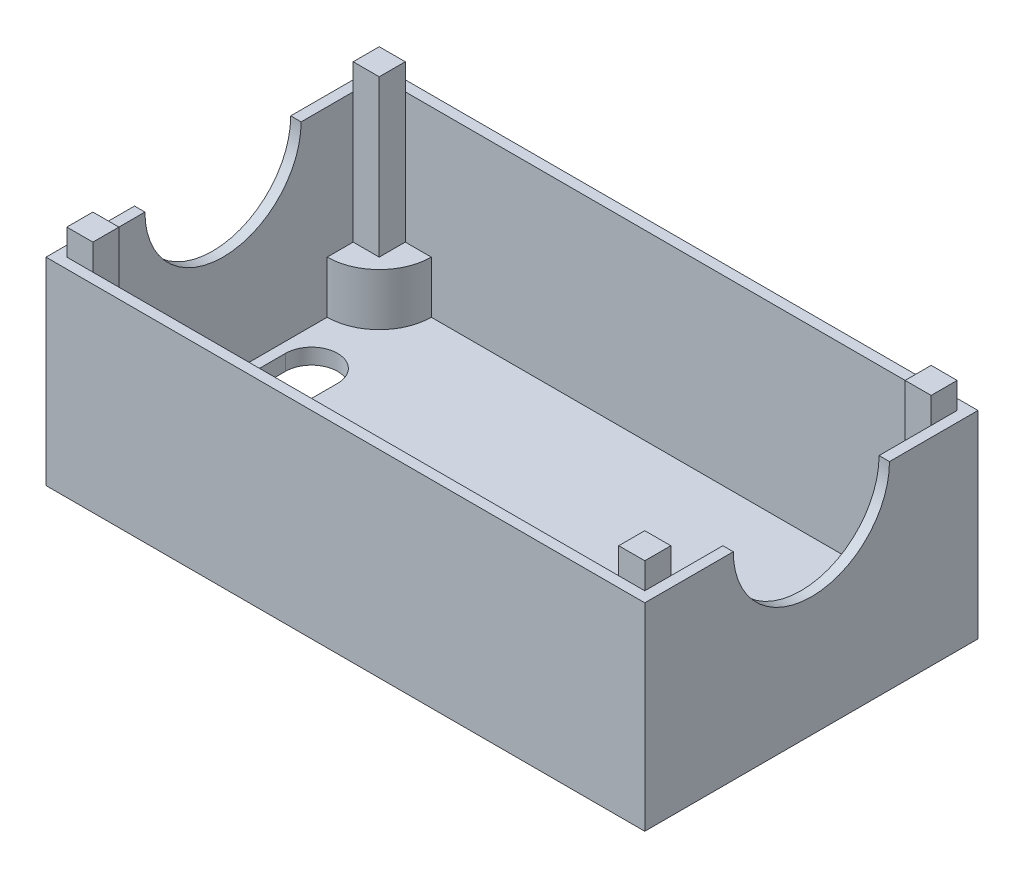
from build123d import *

# Parameters (mm, degrees)
SKETCH1_W                = 115
SKETCH1_H                = 64
BOSS_EXTRUDE1_DEPTH      = 3
SKETCH2_W                = 115
SKETCH2_H                = 64
SKETCH2_W_2              = 111
SKETCH2_H_2              = 60
BOSS_EXTRUDE2_DEPTH      = 35
BOSS_EXTRUDE9_DEPTH      = 5
BOSS_EXTRUDE9_DEPTH_BACK = 37
SKETCH12_W               = 5
SKETCH12_H               = 5
CUT_EXTRUDE6_DEPTH       = 78.008116455
BOSS_EXTRUDE11_DEPTH     = 10
SKETCH19_W               = 5.5
SKETCH19_H               = 5.5
CUT_EXTRUDE7_DEPTH       = 7
FILLET2_R                = 10
SKETCH20_R               = 15
CUT_EXTRUDE8_DEPTH       = 127.877894056


with BuildPart() as part:
    # Sketch1 → Boss-Extrude1 (new body)
    with BuildSketch(Plane(origin=(0, 0, 0), x_dir=(1, 0, 0), z_dir=(0, 1, 0))):
        Rectangle(SKETCH1_W, SKETCH1_H)
    extrude(amount=BOSS_EXTRUDE1_DEPTH)

    # Sketch2 → Boss-Extrude2 (add)
    with BuildSketch(Plane(origin=(0, 3, 0), x_dir=(1, 0, 0), z_dir=(0, 1, 0))):
        Rectangle(SKETCH2_W, SKETCH2_H)
        Rectangle(SKETCH2_W_2, SKETCH2_H_2, mode=Mode.SUBTRACT)
    extrude(amount=BOSS_EXTRUDE2_DEPTH)

    # Sketch12 → Boss-Extrude9 (add, two sides: drawn at the far end of the back side and taken through both)
    with BuildSketch(Plane(origin=(0, 38, 0), x_dir=(1, 0, 0), z_dir=(0, 1, 0)).offset(-BOSS_EXTRUDE9_DEPTH_BACK)):
        with Locations((-53, 27.5)):
            Rectangle(SKETCH12_W, SKETCH12_H)
        with Locations((53, 27.5)):
            Rectangle(SKETCH12_W, SKETCH12_H)
        with Locations((53, -27.5)):
            Rectangle(SKETCH12_W, SKETCH12_H)
        with Locations((-53, -27.5)):
            Rectangle(SKETCH12_W, SKETCH12_H)
    extrude(amount=BOSS_EXTRUDE9_DEPTH + BOSS_EXTRUDE9_DEPTH_BACK)

    # Sketch14 → Cut-Extrude6 (cut, through all)
    with BuildSketch(Plane(origin=(0, 3, 0), x_dir=(1, 0, 0), z_dir=(0, 1, 0))):
        with BuildLine():
            Line((-53.5, -10), (-53.5, 10))
            ThreePointArc((-53.5, 10), (-48.5, 15), (-43.5, 10))
            Line((-43.5, 10), (-43.5, -10))
            ThreePointArc((-43.5, -10), (-48.5, -15), (-53.5, -10))
        make_face()
    extrude(amount=-CUT_EXTRUDE6_DEPTH, mode=Mode.SUBTRACT)

    # Sketch17 → Boss-Extrude11 (add)
    with BuildSketch(Plane(origin=(0, 3, 0), x_dir=(1, 0, 0), z_dir=(0, 1, 0))):
        Polygon((-45.5, 30), (-50.5, 30), (-50.5, 25), (-55.5, 25), (-55.5, 20), (-45.5, 20), align=None)
        Polygon((50.5, 30), (45.5, 30), (45.5, 20), (55.5, 20), (55.5, 25), (50.5, 25), align=None)
        Polygon((55.5, -25), (55.5, -20), (45.5, -20), (45.5, -30), (50.5, -30), (50.5, -25), align=None)
        Polygon((-45.5, -20), (-55.5, -20), (-55.5, -25), (-50.5, -25), (-50.5, -30), (-45.5, -30), align=None)
    extrude(amount=BOSS_EXTRUDE11_DEPTH)

    # Sketch19 → Cut-Extrude7 (cut)
    with BuildSketch(Plane.XZ):
        with Locations((-52.75, 27.25)):
            Rectangle(SKETCH19_W, SKETCH19_H)
        with Locations((52.75, 27.25)):
            Rectangle(SKETCH19_W, SKETCH19_H)
        with Locations((52.75, -27.25)):
            Rectangle(SKETCH19_W, SKETCH19_H)
        with Locations((-52.75, -27.25)):
            Rectangle(SKETCH19_W, SKETCH19_H)
    extrude(amount=-CUT_EXTRUDE7_DEPTH, mode=Mode.SUBTRACT)

    # Fillet2
    fillet2_edges = [part.edges().sort_by_distance(p)[0] for p in [
        (-45.5, 8, 20),
        (45.5, 8, -20),
        (45.5, 8, 20),
        (-45.5, 8, -20),
    ]]
    fillet(fillet2_edges, radius=FILLET2_R - 0.0001)  # a hair under: the kernel refuses the full size

    # Sketch20 → Cut-Extrude8 (cut, through all)
    with BuildSketch(Plane.ZY.offset(57.5)):
        with Locations((0, 38)):
            Circle(SKETCH20_R)
    extrude(amount=-CUT_EXTRUDE8_DEPTH, mode=Mode.SUBTRACT)


solid = part.part
